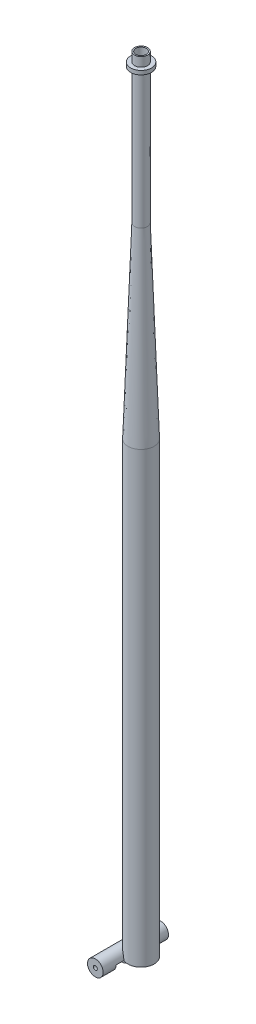
from build123d import *

# Parameters (mm, degrees)
ESQUISSE1_R                  = 5
BOSS_EXTRU_1_DEPTH           = 600
ESQUISSE2_R                  = 10
BOSS_EXTRU_2_DEPTH           = 200
CHANFREIN1_SIZE              = 10
CHANFREIN1_SIZE_2            = 286.362532829
ESQUISSE3_R                  = 4
ENL_V_MAT_EXTRU_1_DEPTH      = 601.166643525
ESQUISSE4_R                  = 8
ESQUISSE4_R_2                = 4.5
BOSS_EXTRU_3_DEPTH           = 3
ESQUISSE5_R                  = 6
BOSS_EXTRU_4_DEPTH           = 25
ENL_V_MAT_EXTRU_2_DEPTH      = 601.733718055
ENL_V_MAT_EXTRU_2_DEPTH_BACK = 601.733718055
ESQUISSE6_W                  = 10
ESQUISSE6_H                  = 13.340291415
ESQUISSE7_R                  = 1.5
ENL_V_MAT_EXTRU_3_DEPTH      = 603.292287858


with BuildPart() as part:
    # Esquisse1 → Boss.-Extru.1 (new body)
    with BuildSketch(Plane(origin=(0, 0, 0), x_dir=(1, 0, 0), z_dir=(0, 1, 0))):
        with Locations(Location((0, 0, 0), (0, 0, 270))):
            Circle(ESQUISSE1_R)
    extrude(amount=BOSS_EXTRU_1_DEPTH)

    # Esquisse2 → Boss.-Extru.2 (add)
    with BuildSketch(Plane(origin=(0, 0, 0), x_dir=(1, 0, 0), z_dir=(0, 1, 0))):
        with Locations(Location((0, 0, 0), (0, 0, 90))):
            Circle(ESQUISSE2_R)
    extrude(amount=BOSS_EXTRU_2_DEPTH)

    # Chanfrein1
    # the kernel refuses this chamfer: 286.362532829, 10 mm, written as the material it adds along each edge
    with BuildSketch(Plane(origin=(0, 200, 0), x_dir=(0, 0, 1), z_dir=(1, 0, 0))) as chanfrein1_piece_1_section:
        Polygon((5 + CHANFREIN1_SIZE, 0), (5, -CHANFREIN1_SIZE_2), (5, 0), align=None)
    chanfrein1_piece_1 = revolve(axis=Axis((0, 200, 0), (0, -1, 0)), mode=Mode.PRIVATE)
    chanfrein1_piece_1 = chanfrein1_piece_1 & Plane(origin=(0, 318.034394442, 0), x_dir=(0, 0, -1), z_dir=(0, -1, 0)) * Cylinder(10, 1146, mode=Mode.PRIVATE)
    add(chanfrein1_piece_1)

    # Esquisse3 → Enlèv. mat.-Extru.1 (cut, through all)
    with BuildSketch(Plane(origin=(0, 600, 0), x_dir=(1, 0, 0), z_dir=(0, 1, 0))):
        with Locations(Location((0, 0, 0), (0, 0, 270))):
            Circle(ESQUISSE3_R)
    extrude(amount=-ENL_V_MAT_EXTRU_1_DEPTH, mode=Mode.SUBTRACT)

    # Esquisse4 → Boss.-Extru.3 (add)
    with BuildSketch(Plane(origin=(0, 590, 0), x_dir=(1, 0, 0), z_dir=(0, 1, 0))):
        with Locations(Location((0, 0, 0), (0, 0, 270))):
            Circle(ESQUISSE4_R)
        Circle(ESQUISSE4_R_2, mode=Mode.SUBTRACT)
    extrude(amount=BOSS_EXTRU_3_DEPTH)

    # Esquisse5 → Boss.-Extru.4 (add, symmetric)
    with BuildSketch(Plane.XY):
        with Locations((-10, 0)):
            Circle(ESQUISSE5_R)
    extrude(amount=BOSS_EXTRU_4_DEPTH, both=True)

    # Esquisse6 → Enlèv. mat.-Extru.2 (cut, two sides: drawn at the far end of the back side and taken through both)
    with BuildSketch(Plane(origin=(0, 0, 0), x_dir=(0, 0, -1), z_dir=(1, 0, 0)).offset(-ENL_V_MAT_EXTRU_2_DEPTH_BACK)):
        with Locations((-10, -6.670145708)):
            Rectangle(ESQUISSE6_W, ESQUISSE6_H)
        with Locations((10, -6.670145708)):
            Rectangle(ESQUISSE6_W, ESQUISSE6_H)
    extrude(amount=ENL_V_MAT_EXTRU_2_DEPTH + ENL_V_MAT_EXTRU_2_DEPTH_BACK, mode=Mode.SUBTRACT)

    # Esquisse7 → Enlèv. mat.-Extru.3 (cut, through all)
    with BuildSketch(Plane.XY.offset(25)):
        with Locations((-10, 0)):
            Circle(ESQUISSE7_R)
    extrude(amount=-ENL_V_MAT_EXTRU_3_DEPTH, mode=Mode.SUBTRACT)


solid = part.part
